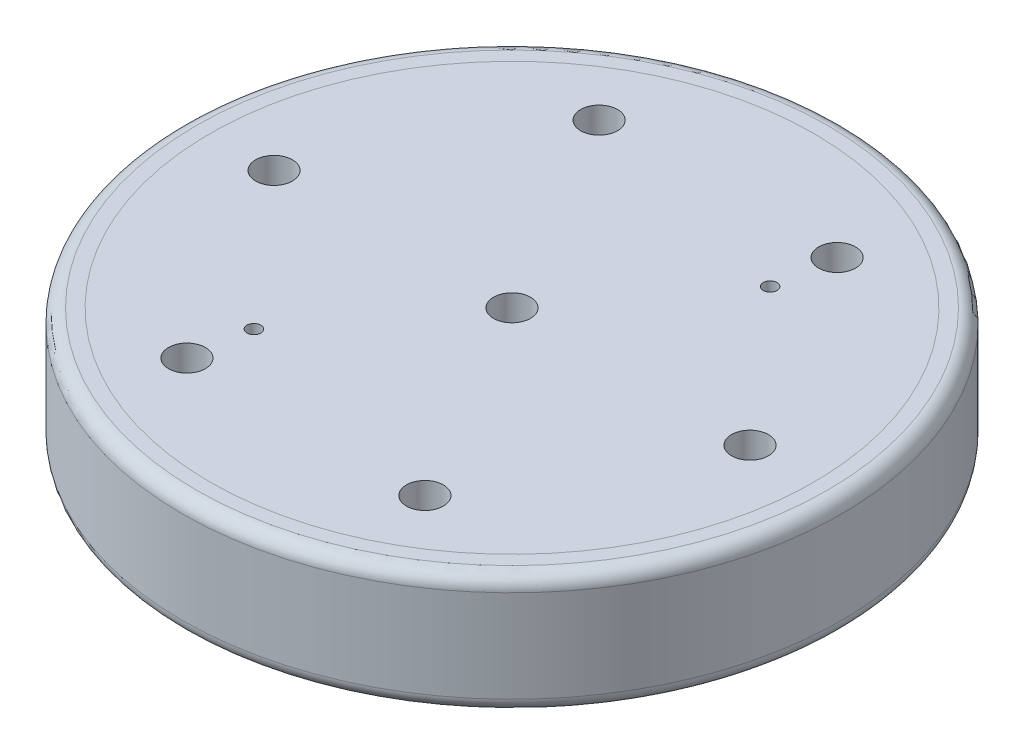
from build123d import *

# Parameters (mm, degrees)
CROQUIS1_R              = 32.75
SALIENTE_EXTRUIR1_DEPTH = 3
CROQUIS2_R              = 2
CORTAR_EXTRUIR1_DEPTH   = 4
CORTAR_EXTRUIR4_DEPTH   = 10
CROQUIS8_R              = 35.75
CROQUIS8_R_2            = 32.75
SALIENTE_EXTRUIR2_DEPTH = 13
REDONDEO1_R             = 1.5
CROQUIS9_R              = 0.75
CORTAR_EXTRUIR5_DEPTH   = 10


with BuildPart() as part:
    # Croquis1 → Saliente-Extruir1 (new body)
    with BuildSketch(Plane(origin=(0, 0, 0), x_dir=(1, 0, 0), z_dir=(0, 1, 0))):
        with Locations(Location((0, 0, 0), (0, 0, 270))):
            Circle(CROQUIS1_R)
    extrude(amount=SALIENTE_EXTRUIR1_DEPTH)

    # Croquis2 → Cortar-Extruir1 (cut)
    with BuildSketch(Plane(origin=(0, 3, 0), x_dir=(1, 0, 0), z_dir=(0, 1, 0))):
        with Locations(Location((0, 0, 0), (0, 0, 270))):
            Circle(CROQUIS2_R)
    extrude(amount=-CORTAR_EXTRUIR1_DEPTH, mode=Mode.SUBTRACT)

    # Croquis7 → Cortar-Extruir4 (cut)
    with BuildSketch(Plane(origin=(0, 3, 0), x_dir=(1, 0, 0), z_dir=(0, 1, 0))):
        with BuildLine():
            ThreePointArc((-13.907029535, 20.623580122), (-11.907029535, 20.623580122), (-10.907029535, 22.355630929))
            Line((-10.907029535, 22.355630929), (-12.907029535, 22.355630929))
            Line((-12.907029535, 22.355630929), (-13.907029535, 20.623580122))
        make_face()
        with BuildLine():
            Line((-12.907029535, 22.355630929), (-10.907029535, 22.355630929))
            ThreePointArc((-10.907029535, 22.355630929), (-13.907029535, 24.087681737), (-13.907029535, 20.623580122))
            Line((-13.907029535, 20.623580122), (-12.907029535, 22.355630929))
        make_face()
        with BuildLine():
            ThreePointArc((-23.81405907, 0), (-24.082008262, 1), (-24.81405907, 1.732050808))
            Line((-24.81405907, 1.732050808), (-25.81405907, 0))
            Line((-25.81405907, 0), (-24.81405907, -1.732050808))
            ThreePointArc((-24.81405907, -1.732050808), (-24.082008262, -1), (-23.81405907, 0))
        make_face()
        with BuildLine():
            Line((-25.81405907, 0), (-24.81405907, 1.732050808))
            ThreePointArc((-24.81405907, 1.732050808), (-27.81405907, 0), (-24.81405907, -1.732050808))
            Line((-24.81405907, -1.732050808), (-25.81405907, 0))
        make_face()
        with BuildLine():
            ThreePointArc((10.907029535, 22.355630929), (11.907029535, 20.623580122), (13.907029535, 20.623580122))
            Line((13.907029535, 20.623580122), (12.907029535, 22.355630929))
            Line((12.907029535, 22.355630929), (10.907029535, 22.355630929))
        make_face()
        with BuildLine():
            Line((12.907029535, 22.355630929), (13.907029535, 20.623580122))
            ThreePointArc((13.907029535, 20.623580122), (14.639080343, 21.355630929), (14.907029535, 22.355630929))
            ThreePointArc((14.907029535, 22.355630929), (12.907029535, 24.355630929), (10.907029535, 22.355630929))
            Line((10.907029535, 22.355630929), (12.907029535, 22.355630929))
        make_face()
        with BuildLine():
            Line((24.81405907, -1.732050808), (25.81405907, 0))
            Line((25.81405907, 0), (24.81405907, 1.732050808))
            ThreePointArc((24.81405907, 1.732050808), (23.81405907, 0), (24.81405907, -1.732050808))
        make_face()
        with BuildLine():
            Line((24.81405907, 1.732050808), (25.81405907, 0))
            Line((25.81405907, 0), (24.81405907, -1.732050808))
            ThreePointArc((24.81405907, -1.732050808), (26.81405907, -1.732050808), (27.81405907, 0))
            ThreePointArc((27.81405907, 0), (26.81405907, 1.732050808), (24.81405907, 1.732050808))
        make_face()
        with BuildLine():
            ThreePointArc((-13.907029535, -20.623580122), (-13.907029535, -24.087681737), (-10.907029535, -22.355630929))
            Line((-10.907029535, -22.355630929), (-12.907029535, -22.355630929))
            Line((-12.907029535, -22.355630929), (-13.907029535, -20.623580122))
        make_face()
        with BuildLine():
            Line((-12.907029535, -22.355630929), (-10.907029535, -22.355630929))
            ThreePointArc((-10.907029535, -22.355630929), (-11.907029535, -20.623580122), (-13.907029535, -20.623580122))
            Line((-13.907029535, -20.623580122), (-12.907029535, -22.355630929))
        make_face()
        with BuildLine():
            ThreePointArc((14.907029535, -22.355630929), (14.639080343, -21.355630929), (13.907029535, -20.623580122))
            Line((13.907029535, -20.623580122), (12.907029535, -22.355630929))
            Line((12.907029535, -22.355630929), (10.907029535, -22.355630929))
            ThreePointArc((10.907029535, -22.355630929), (12.907029535, -24.355630929), (14.907029535, -22.355630929))
        make_face()
        with BuildLine():
            Line((12.907029535, -22.355630929), (13.907029535, -20.623580122))
            ThreePointArc((13.907029535, -20.623580122), (11.907029535, -20.623580122), (10.907029535, -22.355630929))
            Line((10.907029535, -22.355630929), (12.907029535, -22.355630929))
        make_face()
    extrude(amount=-CORTAR_EXTRUIR4_DEPTH, mode=Mode.SUBTRACT)

    # Croquis9 → Cortar-Extruir5 (cut)
    with BuildSketch(Plane(origin=(0, 3, 0), x_dir=(1, 0, 0), z_dir=(0, 1, 0))):
        with Locations(Location((12, 16, 0), (0, 0, 270))):
            Circle(CROQUIS9_R)
        with Locations(Location((-12, -16, 0), (0, 0, 270))):
            Circle(CROQUIS9_R)
    extrude(amount=-CORTAR_EXTRUIR5_DEPTH, mode=Mode.SUBTRACT)


with BuildPart() as body_2:
    # Croquis8 → Saliente-Extruir2 (new body)
    with BuildSketch(Plane(origin=(0, 3, 0), x_dir=(1, 0, 0), z_dir=(0, 1, 0))):
        with Locations(Location((0, 0, 0), (0, 0, 270))):
            Circle(CROQUIS8_R)
        with Locations(Location((0, 0, 0), (0, 0, 270))):
            Circle(CROQUIS8_R_2, mode=Mode.SUBTRACT)
    extrude(amount=-SALIENTE_EXTRUIR2_DEPTH)

    # Redondeo1
    redondeo1_edges = [body_2.edges().sort_by_distance(p)[0] for p in [
        (0, 3, -35.75),
        (0, -10, -35.75),
        (0, -10, -32.75),
    ]]
    fillet(redondeo1_edges, radius=REDONDEO1_R - 0.0001)  # a hair under: the kernel refuses the full size


solid = Compound([part.part, body_2.part])
